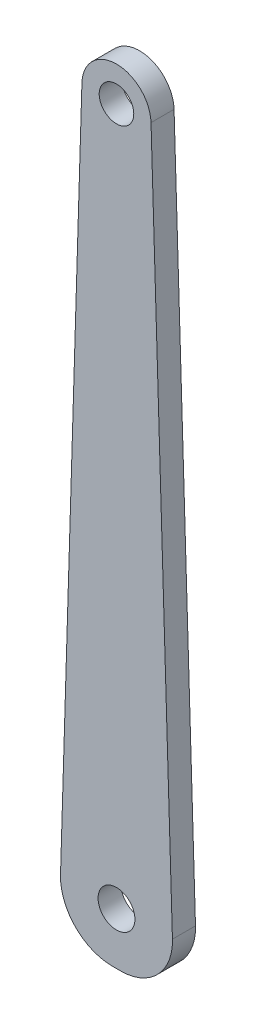
from build123d import *

# Parameters (mm, degrees)
ESQUISSE1_R               = 15
T_LE_DE_BASE_PLI_E1_DEPTH = 20
ESQUISSE6_R               = 16
ENL_V_MAT_EXTRU_1_DEPTH   = 688.604537507
CONG_4_R                  = 45


# Sheet-metal steps are written as plain solids
with BuildPart() as part:
    # Esquisse1 → Tôle de base pliée1 (new body)
    with BuildSketch(Plane.XY):
        with BuildLine():
            Line((0, 0), (100, 0))
            Line((100, 0), (79.985828991, 650.921986845))
            ThreePointArc((79.985828991, 650.921986845), (50, 680), (20.014171009, 650.921986845))
            Line((20.014171009, 650.921986845), (0, 0))
        make_face()
        with Locations((50, 650)):
            Circle(ESQUISSE1_R, mode=Mode.SUBTRACT)
    extrude(amount=-T_LE_DE_BASE_PLI_E1_DEPTH)

    # Esquisse6 → Enlèv. mat.-Extru.1 (cut, through all)
    with BuildSketch(Plane.XY):
        with Locations((50, 45)):
            Circle(ESQUISSE6_R)
    extrude(amount=-ENL_V_MAT_EXTRU_1_DEPTH, mode=Mode.SUBTRACT)

    # Congé4
    cong_4_edges = [part.edges().sort_by_distance(p)[0] for p in [
        (100, 0, -10),
        (0, 0, -10),
    ]]
    fillet(cong_4_edges, radius=CONG_4_R)


solid = part.part
